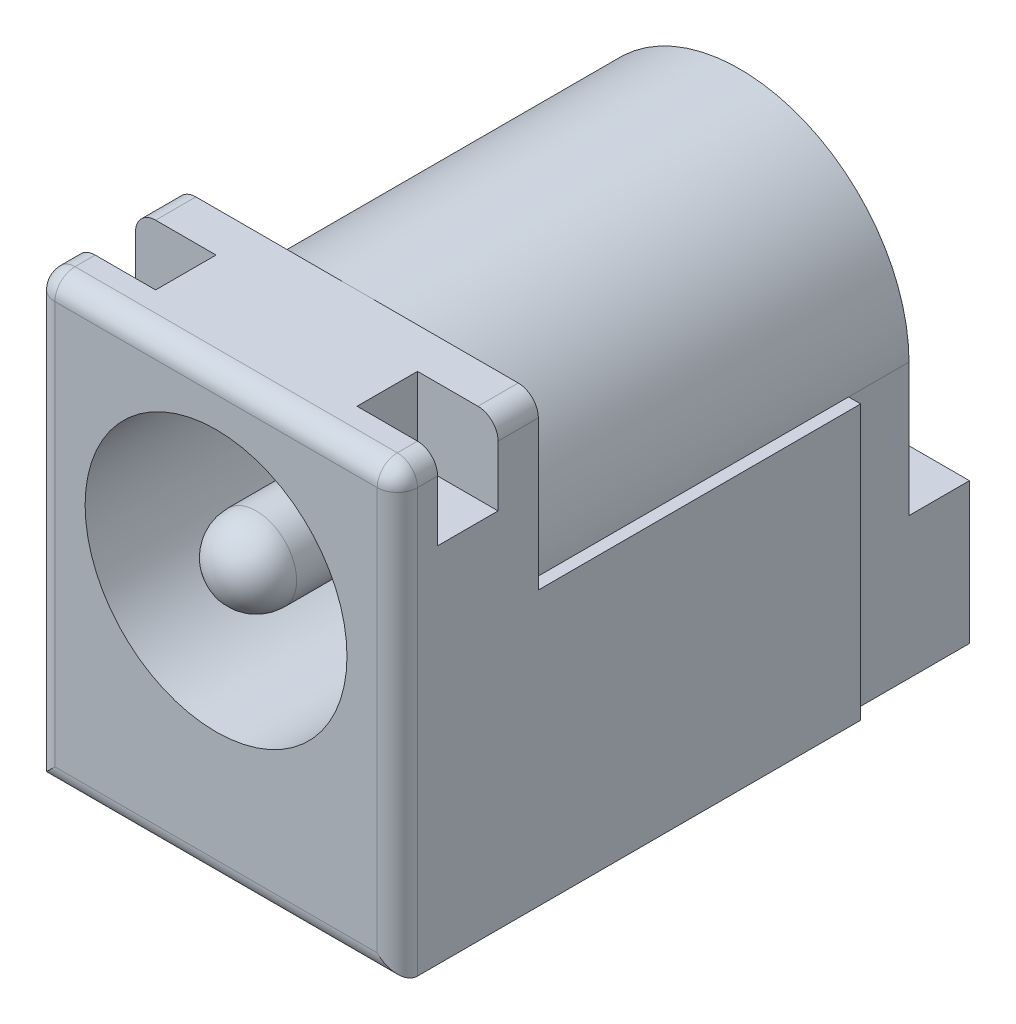
from build123d import *

# Parameters (mm, degrees)
SKETCH1_W           = 9
SKETCH1_H           = 11
BOSS_EXTRUDE1_DEPTH = 14.5
CUT_EXTRUDE3_DEPTH  = 11
SKETCH3_W           = 3
SKETCH3_H           = 6.8
CUT_EXTRUDE4_DEPTH  = 0.3
SKETCH5_W           = 1.5
SKETCH5_H           = 7.5
CUT_EXTRUDE5_DEPTH  = 18.781732199
SKETCH6_W           = 3.5
SKETCH6_H           = 3.5
CUT_EXTRUDE6_DEPTH  = 1.5
BOSS_EXTRUDE2_DEPTH = 0.5
SKETCH8_R           = 1.375
SKETCH8_R_2         = 1
BOSS_EXTRUDE3_DEPTH = 0.5
CHAMFER1_SIZE       = 0.5
SKETCH9_W           = 2.5
SKETCH9_H           = 0.5
BOSS_EXTRUDE4_DEPTH = 6
CUT_EXTRUDE8_DEPTH  = 0.5
SKETCH11_R          = 0.6
CUT_EXTRUDE9_DEPTH  = 17.83745824
SKETCH12_W          = 1.5
SKETCH12_H          = 2
CUT_EXTRUDE10_DEPTH = 2
SKETCH13_R          = 3.25
SKETCH13_R_2        = 1
CUT_EXTRUDE11_DEPTH = 12
FILLET1_R           = 1
FILLET2_R           = 0.5


with BuildPart() as part:
    # Sketch1 → Boss-Extrude1 (new body)
    with BuildSketch(Plane.XY):
        Rectangle(SKETCH1_W, SKETCH1_H)
    extrude(amount=-BOSS_EXTRUDE1_DEPTH)

    # Sketch2 → Cut-Extrude3 (cut)
    with BuildSketch(Plane(origin=(0, 0, -14.5), x_dir=(-1, 0, 0), z_dir=(0, 0, -1))):
        with BuildLine():
            Line((-4.5, 1.3), (-4.2, 1.3))
            ThreePointArc((-4.2, 1.3), (-2.969848481, 4.269848481), (0, 5.5))
            Line((0, 5.5), (-4.5, 5.5))
            Line((-4.5, 5.5), (-4.5, 1.3))
        make_face()
        with BuildLine():
            ThreePointArc((0, 5.5), (2.969848481, 4.269848481), (4.2, 1.3))
            Line((4.2, 1.3), (4.5, 1.3))
            Line((4.5, 1.3), (4.5, 5.5))
            Line((4.5, 5.5), (0, 5.5))
        make_face()
    extrude(amount=-CUT_EXTRUDE3_DEPTH, mode=Mode.SUBTRACT)

    # Sketch3 → Cut-Extrude4 (cut)
    with BuildSketch(Plane(origin=(4.5, 0, 0), x_dir=(0, 0, -1), z_dir=(1, 0, 0))):
        with Locations((13, -2.1)):
            Rectangle(SKETCH3_W, SKETCH3_H)
    cut_extrude4 = extrude(amount=-CUT_EXTRUDE4_DEPTH, mode=Mode.SUBTRACT)

    # Mirror1: Cut-Extrude4 across plane
    add(cut_extrude4.mirror(Plane(origin=(0, 0, 0), x_dir=(0, 0, 1), z_dir=(1, 0, 0))), mode=Mode.SUBTRACT)

    # Sketch5 → Cut-Extrude5 (cut, through all)
    with BuildSketch(Plane(origin=(4.2, 0, 0), x_dir=(0, 0, -1), z_dir=(1, 0, 0))):
        with Locations((13.75, 1.75)):
            Rectangle(SKETCH5_W, SKETCH5_H)
    extrude(amount=-CUT_EXTRUDE5_DEPTH, mode=Mode.SUBTRACT)

    # Sketch6 → Cut-Extrude6 (cut)
    with BuildSketch(Plane(origin=(0, 0, -14.5), x_dir=(-1, 0, 0), z_dir=(0, 0, -1))):
        with Locations((0, -3.75)):
            Rectangle(SKETCH6_W, SKETCH6_H)
    extrude(amount=-CUT_EXTRUDE6_DEPTH, mode=Mode.SUBTRACT)

    # Sketch7 → Boss-Extrude2 (add)
    with BuildSketch(Plane(origin=(0, 0, -13), x_dir=(-1, 0, 0), z_dir=(0, 0, -1))):
        with BuildLine():
            Line((1.5, 1.3), (1.5, -7.5))
            ThreePointArc((1.5, -7.5), (0, -9), (-1.5, -7.5))
            Line((-1.5, -7.5), (-1.5, 1.3))
            ThreePointArc((-1.5, 1.3), (0, 2.8), (1.5, 1.3))
        make_face()
    extrude(amount=BOSS_EXTRUDE2_DEPTH)

    # Sketch8 → Boss-Extrude3 (add)
    with BuildSketch(Plane(origin=(0, 0, -13.5), x_dir=(-1, 0, 0), z_dir=(0, 0, -1))):
        with Locations((0, 1.3)):
            Circle(SKETCH8_R)
        with Locations((0, 1.3)):
            Circle(SKETCH8_R_2, mode=Mode.SUBTRACT)
    extrude(amount=BOSS_EXTRUDE3_DEPTH)

    # Chamfer1
    # the kernel refuses this chamfer: 0.5 mm, written as the material it takes off along each edge
    with BuildSketch(Plane(origin=(0, 1.3, -14), x_dir=(-1, 0, 0), z_dir=(0, -1, 0))) as chamfer1_piece_1_section:
        Polygon((1.375, -CHAMFER1_SIZE), (1.375 - CHAMFER1_SIZE, 0), (1.375, 0), align=None)
    chamfer1_piece_1 = revolve(axis=Axis((0, 1.3, -14), (0, 0, -1)), mode=Mode.PRIVATE)
    chamfer1_piece_1 = split(chamfer1_piece_1, bisect_by=Plane(origin=(1.125101861, 1.3, -13.5), z_dir=(0, 0, -1)), keep=Keep.TOP, mode=Mode.PRIVATE)
    add(chamfer1_piece_1, mode=Mode.SUBTRACT)

    # Sketch9 → Boss-Extrude4 (add)
    with BuildSketch(Plane.XZ.offset(5.5)):
        with Locations((0, -7.25)):
            Rectangle(SKETCH9_W, SKETCH9_H)
    extrude(amount=BOSS_EXTRUDE4_DEPTH)

    # Sketch10 → Cut-Extrude8 (cut)
    with BuildSketch(Plane.XY.offset(-7)):
        with BuildLine():
            ThreePointArc((1.25, -8.329156198), (0, -9), (-1.25, -8.329156198))
            Line((-1.25, -8.329156198), (-1.25, -11.5))
            Line((-1.25, -11.5), (1.25, -11.5))
            Line((1.25, -11.5), (1.25, -8.329156198))
        make_face()
    extrude(amount=-CUT_EXTRUDE8_DEPTH, mode=Mode.SUBTRACT)

    # Sketch11 → Cut-Extrude9 (cut, through all)
    with BuildSketch(Plane(origin=(0, 0, -13.5), x_dir=(-1, 0, 0), z_dir=(0, 0, -1))):
        with Locations((0, -7.5)):
            Circle(SKETCH11_R)
    extrude(amount=-CUT_EXTRUDE9_DEPTH, mode=Mode.SUBTRACT)

    # Sketch12 → Cut-Extrude10 (cut)
    with BuildSketch(Plane(origin=(4.5, 0, 0), x_dir=(0, 0, -1), z_dir=(1, 0, 0))):
        with Locations((1.75, 4.5)):
            Rectangle(SKETCH12_W, SKETCH12_H)
    cut_extrude10 = extrude(amount=-CUT_EXTRUDE10_DEPTH, mode=Mode.SUBTRACT)

    # Mirror2: Cut-Extrude10 across plane
    add(cut_extrude10.mirror(Plane(origin=(0, 0, 0), x_dir=(0, 0, 1), z_dir=(1, 0, 0))), mode=Mode.SUBTRACT)

    # Sketch13 → Cut-Extrude11 (cut)
    with BuildSketch(Plane.XY):
        with Locations((0, 1)):
            Circle(SKETCH13_R)
        with Locations((0, 1)):
            Circle(SKETCH13_R_2, mode=Mode.SUBTRACT)
    extrude(amount=-CUT_EXTRUDE11_DEPTH, mode=Mode.SUBTRACT)

    # Fillet1
    fillet1_edges = [part.edges().sort_by_distance(p)[0] for p in [
        (-1, 1, 0),
    ]]
    fillet(fillet1_edges, radius=FILLET1_R)

    # Fillet2
    fillet2_edges = [part.edges().sort_by_distance(p)[0] for p in [
        (4.5, 5.5, -3),
        (4.5, 5.5, -0.5),
        (-4.5, 5.5, -0.5),
        (-4.5, 5.5, -3),
        (0, -5.5, 0),
        (-4.5, 0, 0),
        (0, 5.5, 0),
        (4.5, 0, 0),
    ]]
    fillet(fillet2_edges, radius=FILLET2_R)


solid = part.part
